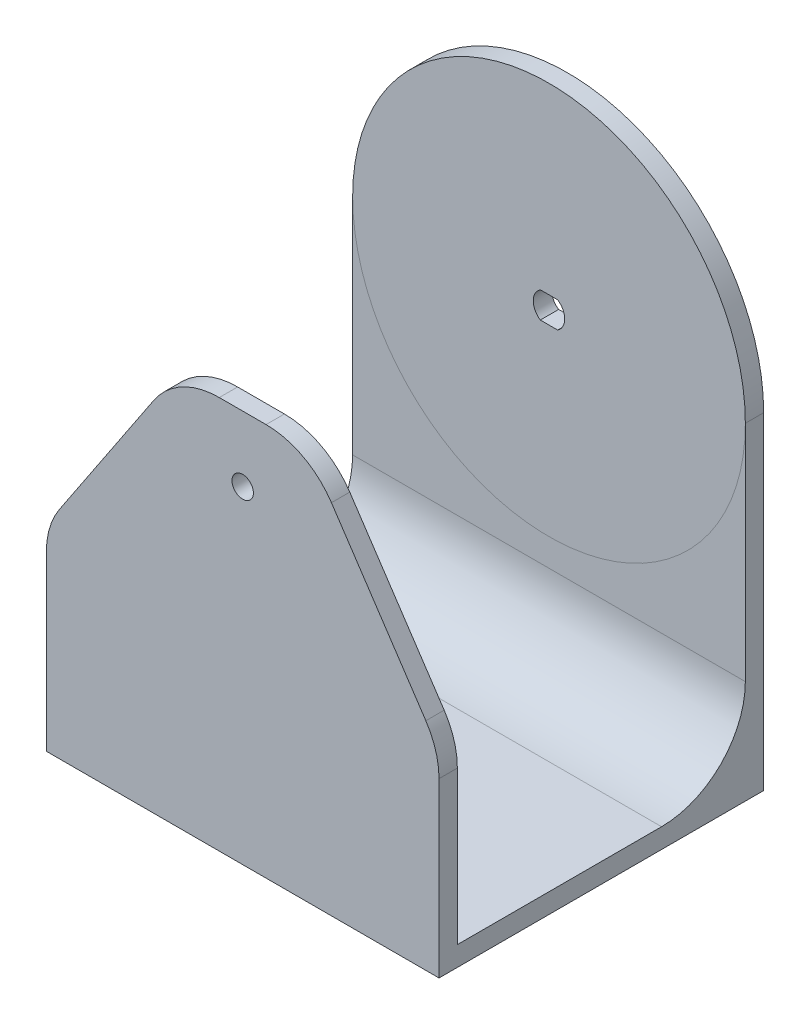
from build123d import *

# Parameters (mm, degrees)
SKETCH2_R           = 75
BOSS_EXTRUDE1_DEPTH = 3.5
BOSS_EXTRUDE2_DEPTH = 7
SKETCH11_W          = 150
SKETCH11_H          = 7.544328289
BOSS_EXTRUDE4_DEPTH = 110
SKETCH12_W          = 150
SKETCH12_H          = 150.044328289
BOSS_EXTRUDE5_DEPTH = 7
SKETCH13_R          = 4.1
CUT_EXTRUDE3_DEPTH  = 7
FILLET1_R           = 32
CUT_EXTRUDE4_DEPTH  = 7
CUT_EXTRUDE5_DEPTH  = 7
FILLET2_R           = 30
FILLET3_R           = 30
FILLET4_R           = 30
FILLET5_R           = 30


with BuildPart() as part:
    # Sketch2 → Boss-Extrude1 (new, symmetric)
    with BuildSketch(Plane.XY):
        Circle(SKETCH2_R)
        with BuildLine():
            Line((-3.31662479, 5), (3.31662479, 5))
            ThreePointArc((3.31662479, 5), (6, 0), (3.31662479, -5))
            Line((3.31662479, -5), (-3.31662479, -5))
            ThreePointArc((-3.31662479, -5), (-6, 0), (-3.31662479, 5))
        make_face(mode=Mode.SUBTRACT)
    extrude(amount=BOSS_EXTRUDE1_DEPTH, both=True)


with BuildPart() as body_2:
    # Sketch8 → Boss-Extrude2 (new body)
    with BuildSketch(Plane.XY.offset(3.5)):
        with BuildLine():
            ThreePointArc((75, 0), (0, -75), (-75, 0))
            Line((-75, 0), (-75, -125))
            Line((-75, -125), (75, -125))
            Line((75, -125), (75, 0))
        make_face()
    extrude(amount=-BOSS_EXTRUDE2_DEPTH)

    # Sketch11 → Boss-Extrude4 (add)
    with BuildSketch(Plane.XY.offset(3.5)):
        with Locations((0, -121.227835856)):
            Rectangle(SKETCH11_W, SKETCH11_H)
    extrude(amount=BOSS_EXTRUDE4_DEPTH)

    # Sketch12 → Boss-Extrude5 (add)
    with BuildSketch(Plane.XY.offset(113.5)):
        with Locations((0, -49.977835856)):
            Rectangle(SKETCH12_W, SKETCH12_H)
    extrude(amount=BOSS_EXTRUDE5_DEPTH)

    # Sketch13 → Cut-Extrude3 (cut)
    with BuildSketch(Plane.XY.offset(120.5)):
        Circle(SKETCH13_R)
    extrude(amount=-CUT_EXTRUDE3_DEPTH, mode=Mode.SUBTRACT)

    # Fillet1
    fillet1_edges = [body_2.edges().sort_by_distance(p)[0] for p in [
        (0, -117.455671711, 3.5),
    ]]
    fillet(fillet1_edges, radius=FILLET1_R)

    # Sketch14 → Cut-Extrude4 (cut)
    with BuildSketch(Plane.XY.offset(120.5)):
        Polygon((-75, -49.977835856), (-25, 25.044328289), (-75, 25.044328289), align=None)
    extrude(amount=-CUT_EXTRUDE4_DEPTH, mode=Mode.SUBTRACT)

    # Sketch16 → Cut-Extrude5 (cut)
    with BuildSketch(Plane.XY.offset(120.5)):
        Polygon((25, 25.044328289), (75, -49.977835856), (75, 25.044328289), align=None)
    extrude(amount=-CUT_EXTRUDE5_DEPTH, mode=Mode.SUBTRACT)

    # Fillet2
    fillet2_edges = [body_2.edges().sort_by_distance(p)[0] for p in [
        (-25, 25.044328289, 117),
    ]]
    fillet(fillet2_edges, radius=FILLET2_R)

    # Fillet3
    fillet3_edges = [body_2.edges().sort_by_distance(p)[0] for p in [
        (25, 25.044328289, 117),
    ]]
    fillet(fillet3_edges, radius=FILLET3_R)

    # Fillet4
    fillet4_edges = [body_2.edges().sort_by_distance(p)[0] for p in [
        (-75, -49.977835856, 117),
    ]]
    fillet(fillet4_edges, radius=FILLET4_R)

    # Fillet5
    fillet5_edges = [body_2.edges().sort_by_distance(p)[0] for p in [
        (75, -49.977835856, 117),
    ]]
    fillet(fillet5_edges, radius=FILLET5_R)


solid = Compound([part.part, body_2.part])
